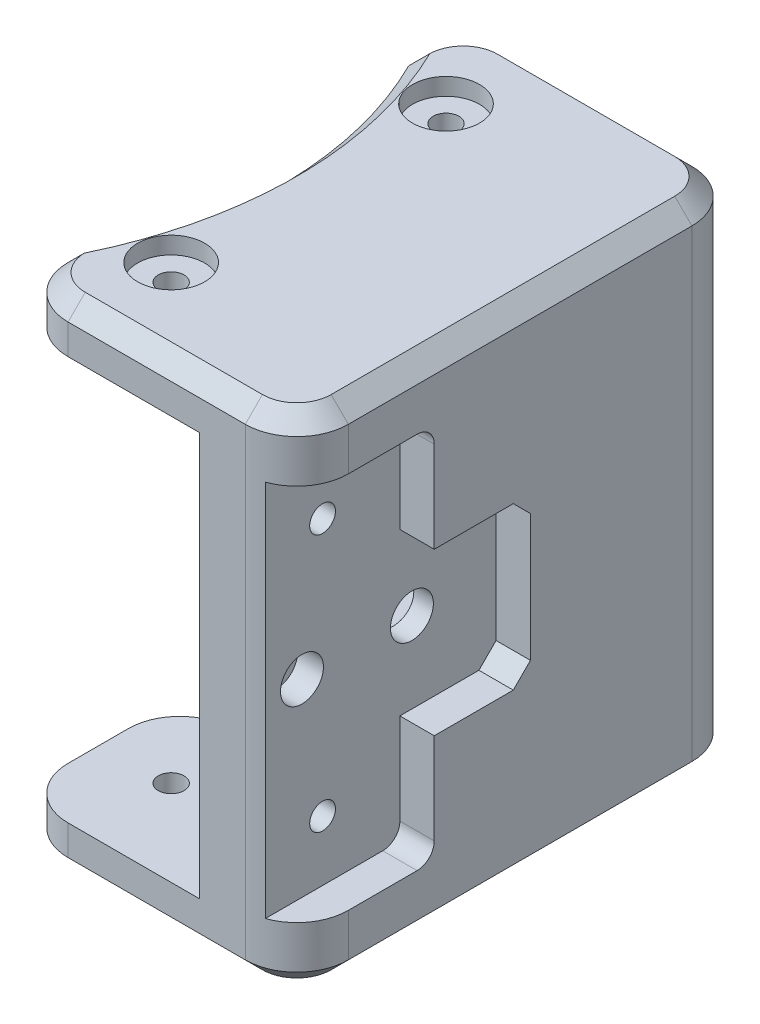
from build123d import *

# Parameters (mm, degrees)
SKETCH_1_W          = 16.31456143534598
SKETCH_1_H          = 26.000000000000004
SKETCH_1_R          = 0.7500000000000021
EXTRUDE_1_DEPTH     = 14.5
SKETCH_2_R          = 33
CUT_EXTRUDE_1_DEPTH = 11.75
CUT_EXTRUDE_2_DEPTH = 2
CUT_EXTRUDE_7_REACH = 50.021
SKETCH_8_R          = 22
FILLET_1_R          = 1
CHAMFER_1_SIZE      = 1
SKETCH_4_R          = 1.2500000000000002
SKETCH_4_R_2        = 1.2499999999999991
CUT_EXTRUDE_3_DEPTH = 1.5
SKETCH_5_R          = 0.7500000000000004
CUT_EXTRUDE_4_DEPTH = 25.169333290066117
CUT_EXTRUDE_5_REACH = 50.021
FILLET_2_R          = 3
CHAMFER_3_SIZE      = 1
SKETCH_7_R          = 1.949999999999999
CUT_EXTRUDE_6_DEPTH = 1
CHAMFER_4_SIZE      = 1


with BuildPart() as part:
    # Эскиз1 → Бобышка-Вытянуть1 (new, symmetric)
    with BuildSketch(Plane(origin=(0, 0, 0), x_dir=(1, 0, 0), z_dir=(0, 1, 0))):
        with Locations((27.84271928232701, 0)):
            Rectangle(SKETCH_1_W, SKETCH_1_H)
        with Locations(Location((23.68543856465402, -8, 0), (0, 0, 90))):
            Circle(SKETCH_1_R, mode=Mode.SUBTRACT)
        with Locations(Location((23.68543856465402, 8, 0), (0, 0, 90))):
            Circle(SKETCH_1_R, mode=Mode.SUBTRACT)
    extrude(amount=EXTRUDE_1_DEPTH, both=True)

    # Эскиз2 → Вырез-Вытянуть1 (cut, symmetric)
    with BuildSketch(Plane(origin=(0, 0, 0), x_dir=(1, 0, 0), z_dir=(0, 1, 0))):
        Circle(SKETCH_2_R)
    extrude(amount=CUT_EXTRUDE_1_DEPTH, both=True, mode=Mode.SUBTRACT)

    # Эскиз3 → Вырез-Вытянуть2 (cut)
    with BuildSketch(Plane(origin=(36, 0, 0), x_dir=(0, 0, -1), z_dir=(1, 0, 0))):
        Polygon((-13.000000000000004, 10.999999999999998), (-5.000000000000003, 10.999999999999996), (-5.000000000000002, 4.699999999999998), (0.5999999999999969, 4.699999999999999), (0.5999999999999981, -4.699999999999999), (-5.000000000000001, -4.7), (-5, -10.999999999999996), (-13, -11.000000000000002), align=None)
    extrude(amount=-CUT_EXTRUDE_2_DEPTH, mode=Mode.SUBTRACT)

    # Эскиз8 → Вырез-Вытянуть7 (cut, up to next)
    with BuildSketch(Plane(origin=(0, 14.5, 0), x_dir=(1, 0, 0), z_dir=(0, 1, 0)), mode=Mode.PRIVATE) as cut_extrude_7_sk1:
        Circle(SKETCH_8_R)
    cut_extrude_7_tool1 = extrude(cut_extrude_7_sk1.sketch, amount=-CUT_EXTRUDE_7_REACH, mode=Mode.PRIVATE) & part.part
    add(cut_extrude_7_tool1.solids().sort_by_distance((0, 14.5, 0))[0], mode=Mode.SUBTRACT)

    # Скругление1
    fillet_1_edges = [part.edges().sort_by_distance(p)[0] for p in [
        (35, 10.999999999999996, 5.000000000000003),
        (35, -10.999999999999996, 5),
    ]]
    fillet(fillet_1_edges, radius=FILLET_1_R)

    # Фаска1
    chamfer_1_edges = [part.edges().sort_by_distance(p)[0] for p in [
        (35, 4.699999999999999, -0.5999999999999969),
        (35, -4.699999999999999, -0.5999999999999981),
    ]]
    chamfer(chamfer_1_edges, length=CHAMFER_1_SIZE)

    # Эскиз4 → Вырез-Вытянуть3 (cut)
    with BuildSketch(Plane(origin=(33.99999999999999, 0, 0), x_dir=(0, 0, -1), z_dir=(1, 0, 0))):
        with Locations((-4.300000000000002, 0)):
            Circle(SKETCH_4_R)
        with Locations((-10.700000000000001, 0)):
            Circle(SKETCH_4_R_2)
    extrude(amount=-CUT_EXTRUDE_3_DEPTH, mode=Mode.SUBTRACT)

    # Эскиз5 → Вырез-Вытянуть4 (cut, through all)
    with BuildSketch(Plane(origin=(33.99999999999999, 0, 0), x_dir=(0, 0, -1), z_dir=(1, 0, 0))):
        with Locations((-9.500000000000002, 7.5)):
            Circle(SKETCH_5_R)
        with Locations((-9.500000000000002, -7.5)):
            Circle(SKETCH_5_R)
    extrude(amount=-CUT_EXTRUDE_4_DEPTH, mode=Mode.SUBTRACT)

    # Эскиз6 → Вырез-Вытянуть5 (cut, up to next)
    with BuildSketch(Plane.XZ.offset(14.5), mode=Mode.PRIVATE) as cut_extrude_5_sk1:
        with BuildLine():
            ThreePointArc((25, -3.5), (21.5, 4.3e-16), (25, 3.5))
            Line((25, 3.5), (19.68543856465402, 3.499999999999999))
            Line((19.68543856465402, 3.499999999999999), (19.68543856465402, -3.500000000000001))
            Line((19.68543856465402, -3.500000000000001), (25, -3.5))
        make_face()
    cut_extrude_5_tool1 = extrude(cut_extrude_5_sk1.sketch, amount=-CUT_EXTRUDE_5_REACH, mode=Mode.PRIVATE) & part.part
    # Эскиз6 → Вырез-Вытянуть5 (cut, up to next)
    with BuildSketch(Plane.XZ.offset(14.5), mode=Mode.PRIVATE) as cut_extrude_5_sk2:
        with BuildLine():
            ThreePointArc((28.5, 0), (27.474873734152915, 2.474873734152916), (25, 3.5))
            Line((25, 3.5), (25, -3.5))
            ThreePointArc((25, -3.5), (27.474873734152915, -2.474873734152917), (28.5, -8.6e-16))
        make_face()
    cut_extrude_5_tool2 = extrude(cut_extrude_5_sk2.sketch, amount=-CUT_EXTRUDE_5_REACH, mode=Mode.PRIVATE) & part.part
    # Эскиз6 → Вырез-Вытянуть5 (cut, up to next)
    with BuildSketch(Plane.XZ.offset(14.5), mode=Mode.PRIVATE) as cut_extrude_5_sk3:
        with BuildLine():
            Line((25, -3.5), (25, 3.5))
            ThreePointArc((25, 3.5), (21.5, 4.3e-16), (25, -3.5))
        make_face()
    cut_extrude_5_tool3 = extrude(cut_extrude_5_sk3.sketch, amount=-CUT_EXTRUDE_5_REACH, mode=Mode.PRIVATE) & part.part
    # Эскиз6 → Вырез-Вытянуть5 (cut, up to next)
    with BuildSketch(Plane.XZ.offset(14.5), mode=Mode.PRIVATE) as cut_extrude_5_sk4:
        with BuildLine():
            ThreePointArc((28.5, 0), (27.474873734152915, 2.474873734152916), (25, 3.5))
            Line((25, 3.5), (25, -3.5))
            ThreePointArc((25, -3.5), (27.474873734152915, -2.474873734152917), (28.5, -8.6e-16))
        make_face()
    cut_extrude_5_tool4 = extrude(cut_extrude_5_sk4.sketch, amount=-CUT_EXTRUDE_5_REACH, mode=Mode.PRIVATE) & part.part
    # Эскиз6 → Вырез-Вытянуть5 (cut, up to next)
    with BuildSketch(Plane.XZ.offset(14.5), mode=Mode.PRIVATE) as cut_extrude_5_sk5:
        with BuildLine():
            Line((25, -3.5), (25, 3.5))
            ThreePointArc((25, 3.5), (21.5, 4.3e-16), (25, -3.5))
        make_face()
    cut_extrude_5_tool5 = extrude(cut_extrude_5_sk5.sketch, amount=-CUT_EXTRUDE_5_REACH, mode=Mode.PRIVATE) & part.part
    add(cut_extrude_5_tool1.solids().sort_by_distance((21.087199, -14.5, 0))[0], mode=Mode.SUBTRACT)
    add(cut_extrude_5_tool2.solids().sort_by_distance((26.485446, -14.5, 0))[0], mode=Mode.SUBTRACT)
    add(cut_extrude_5_tool3.solids().sort_by_distance((23.514554, -14.5, 0))[0], mode=Mode.SUBTRACT)
    add(cut_extrude_5_tool4.solids().sort_by_distance((26.485446, -14.5, 0))[0], mode=Mode.SUBTRACT)
    add(cut_extrude_5_tool5.solids().sort_by_distance((23.514554, -14.5, 0))[0], mode=Mode.SUBTRACT)

    # Скругление2
    fillet_2_edges = [part.edges().sort_by_distance(p)[0] for p in [
        (19.68543856465402, 13.125, -13),
        (19.68543856465402, 13.125, 13),
        (19.68543856465402, -13.125, -13),
        (19.68543856465402, -13.125, 13),
        (36, 0, -13),
        (36, 12.75, 13),
        (19.68543856465402, -13.125, 3.499999999999999),
        (19.68543856465402, -13.125, -3.500000000000001),
    ]]
    fillet(fillet_2_edges, radius=FILLET_2_R)

    # Фаска3
    chamfer_3_edges = [part.edges().sort_by_distance(p)[0] for p in [
        (23.84271928232701, -14.5, -3.5),
        (28.5, -14.5, -2.56e-15),
        (23.84271928232701, -14.5, 3.5),
        (19.68543856465402, -14.5, 8.25),
        (19.68543856465402, -14.5, -8.25),
        (27.84271928232701, -14.5, -13),
        (36, -14.5, 0),
        (27.84271928232701, -14.5, 13),
        (35.121320343559645, -14.5, 12.121320343559642),
        (35.121320343559645, -14.5, -12.121320343559642),
        (20.56411822109438, -14.5, 12.121320343559642),
        (20.56411822109438, -14.5, -12.121320343559642),
        (20.56411822109438, -14.5, -4.378679656440358),
        (20.56411822109438, -14.5, 4.378679656440358),
        (19.68543856465402, 14.5, -9.911300960978625),
        (27.84271928232701, 14.5, -13),
        (27.84271928232701, 14.5, 13),
        (36, 14.5, 0),
        (35.121320343559645, 14.5, 12.121320343559642),
        (35.121320343559645, 14.5, -12.121320343559642),
        (20.56411822109438, 14.5, 12.121320343559642),
        (20.56411822109438, 14.5, -12.121320343559642),
        (19.68543856465402, 14.5, 9.911300960978625),
    ]]
    chamfer(chamfer_3_edges, length=CHAMFER_3_SIZE)

    # Эскиз7 → Вырез-Вытянуть6 (cut)
    with BuildSketch(Plane(origin=(0, 14.5, 0), x_dir=(1, 0, 0), z_dir=(0, 1, 0))):
        with Locations(Location((23.68543856465402, 8, 0), (0, 0, 270))):
            Circle(SKETCH_7_R)
        with Locations(Location((23.68543856465402, -8, 0), (0, 0, 270))):
            Circle(SKETCH_7_R)
    cut_extrude_6 = extrude(amount=-CUT_EXTRUDE_6_DEPTH, mode=Mode.SUBTRACT)

    # Зеркальное отражение1: Вырез-Вытянуть6 across plane
    add(cut_extrude_6.mirror(Plane.ZX), mode=Mode.SUBTRACT)

    # Фаска4
    # the kernel refuses this chamfer: 1 mm, written as the material it takes off along each edge
    with BuildSketch(Plane(origin=(0, 14.5, 0), x_dir=(0.8941152756835695, 0, -0.44783688301578556), z_dir=(-0.44783688301578556, 0, -0.8941152756835695))) as chamfer_4_piece_1:
        Polygon((21.999999999999993 + CHAMFER_4_SIZE, 0), (21.999999999999996, CHAMFER_4_SIZE), (21.999999999999993, 0), align=None)
    revolve(axis=Axis((0, 14.5, 0), (0, -1, 0)), revolution_arc=53.209970164509144, mode=Mode.SUBTRACT)


solid = part.part
